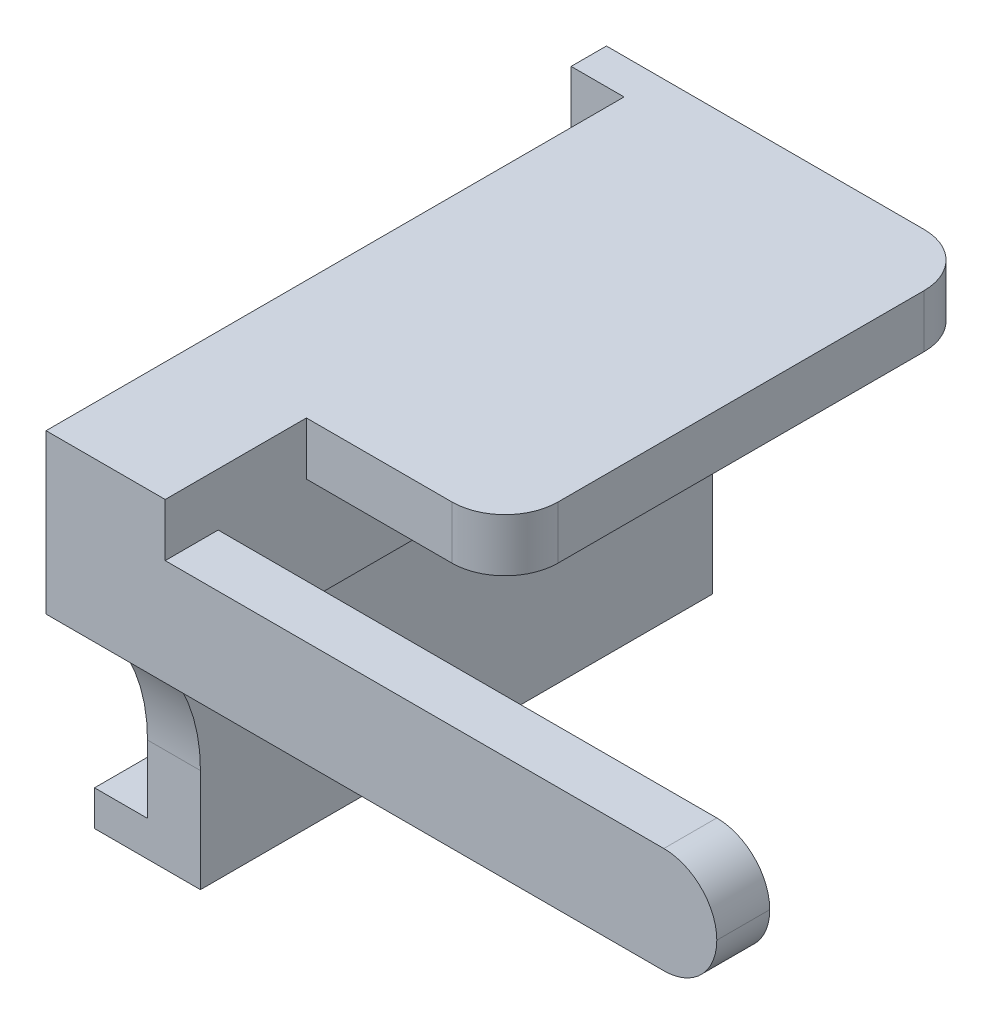
from build123d import *

# Parameters (mm, degrees)
EXTRUDE_1_DEPTH      = 5
EXTRUDE_1_DEPTH_BACK = 3
SKETCH_2_W           = 29
SKETCH_2_H           = 29
SKETCH_3_W           = 25
SKETCH_3_H           = 25
CUT_EXTRUDE_1_DEPTH  = 3
SKETCH_5_R           = 1
CUT_EXTRUDE_3_DEPTH  = 3
CUT_EXTRUDE_4_DEPTH  = 23.011360703
HOLE_WIZARD_M3_1_D   = 2.5
SKETCH_4_W           = 8
SKETCH_4_H           = 29
EXTRUDE_2_DEPTH      = 13.4052
SKETCH_7_W           = 29
SKETCH_7_H           = 5
EXTRUDE_3_DEPTH      = 5
SKETCH_10_W          = 29
SKETCH_10_H          = 13.4052
CUT_EXTRUDE_5_DEPTH  = 35.028667136
EXTRUDE_4_DEPTH      = 28
SKETCH_13_W          = 22.441758485
SKETCH_13_H          = 29
CUT_EXTRUDE_7_DEPTH  = 20.8948
SKETCH_14_W          = 27
SKETCH_14_H          = 6.1052
CUT_EXTRUDE_8_DEPTH  = 10
EXTRUDE_5_DEPTH      = 10
SKETCH_16_W          = 12.441758485
SKETCH_16_H          = 20.8948
CUT_EXTRUDE_9_DEPTH  = 5
CUT_EXTRUDE_10_DEPTH = 5
SKETCH_18_W          = 7.441758485
SKETCH_18_H          = 20.8948
CUT_EXTRUDE_11_DEPTH = 1.9068532
SKETCH_19_W          = 18
SKETCH_19_H          = 8
CUT_EXTRUDE_12_DEPTH = 7
SKETCH_20_W          = 3.0931468
SKETCH_20_H          = 11
EXTRUDE_6_DEPTH      = 20
SKETCH_21_W          = 3.0931468
SKETCH_21_H          = 2.8948
CUT_EXTRUDE_13_DEPTH = 7.441758485
SKETCH_22_W          = 29
SKETCH_22_H          = 7
CUT_EXTRUDE_14_DEPTH = 7.558241515
EXTRUDE_7_DEPTH      = 3
SKETCH_24_W          = 3
SKETCH_24_H          = 11
CUT_EXTRUDE_15_DEPTH = 50.942466899
CUT_EXTRUDE_16_DEPTH = 3.8082415
SKETCH_26_W          = 11.249999985
SKETCH_26_H          = 6.1052
CUT_EXTRUDE_17_DEPTH = 6.0931468
SKETCH_27_W          = 6.0931468
SKETCH_27_H          = 6.1052
CUT_EXTRUDE_18_DEPTH = 43.86096708
CUT_EXTRUDE_19_DEPTH = 3.1052
SKETCH_30_W          = 3.750000015
SKETCH_30_H          = 32.721043552
CUT_EXTRUDE_20_DEPTH = 7.8948
CUT_EXTRUDE_21_DEPTH = 4.9068532
SKETCH_32_W          = 31.249999985
SKETCH_32_H          = 6.0931468
CUT_EXTRUDE_22_DEPTH = 3.5
SKETCH_33_W          = 11
SKETCH_33_H          = 13.8948
EXTRUDE_8_DEPTH      = 3
SKETCH_34_W          = 11
SKETCH_34_H          = 6.3948
CUT_EXTRUDE_25_DEPTH = 49.005208051
EXTRUDE_9_DEPTH      = 0.3948
SKETCH_36_W          = 38
SKETCH_36_H          = 7.8948
CUT_EXTRUDE_26_DEPTH = 2.5931468
CUT_EXTRUDE_27_DEPTH = 3.5
SKETCH_38_W          = 1.185809648
SKETCH_38_H          = 4.3948
CUT_EXTRUDE_28_DEPTH = 3.750000015
EXTRUDE_11_DEPTH     = 3
EXTRUDE_12_REACH     = 51.952
SKETCH_41_W          = 35
SKETCH_41_H          = 4.3948
EXTRUDE_13_DEPTH     = 2.16
SKETCH_42_W          = 11.238283167
SKETCH_42_H          = 6
EXTRUDE_14_DEPTH     = 3
SKETCH_43_W          = 3
SKETCH_43_H          = 6
EXTRUDE_15_DEPTH     = 20.011716818
SKETCH_44_W          = 3.319178761
SKETCH_44_H          = 21.949008861
CUT_EXTRUDE_29_DEPTH = 47.679480755
SKETCH_45_W          = 3
SKETCH_45_H          = 4.3948
CUT_EXTRUDE_30_DEPTH = 35
SKETCH_46_W          = 5.7468532
SKETCH_46_H          = 8.544893469
EXTRUDE_16_DEPTH     = 18
SKETCH_47_W          = 11.249999985
SKETCH_47_H          = 5.544893469
CUT_EXTRUDE_31_DEPTH = 2.7468532
SKETCH_48_W          = 5.7468532
SKETCH_48_H          = 14.8948
CUT_EXTRUDE_32_DEPTH = 43.95561738
SKETCH_49_W          = 8
SKETCH_49_H          = 3
CUT_EXTRUDE_33_DEPTH = 11.249999985
FILLET_3_R           = 10
FILLET_4_R           = 3
HOLE_WIZARD_M4_1_D   = 3.3


# Some blends are built 0.0001 mm under size
with BuildPart() as part:
    # 草图2 → 凸台-拉伸1 (new, two sides: drawn at the far end of the back side and taken through both)
    with BuildSketch(Plane(origin=(0, 0, 0), x_dir=(0, 0, -1), z_dir=(1, 0, 0)).offset(-EXTRUDE_1_DEPTH_BACK)):
        Rectangle(SKETCH_2_W, SKETCH_2_H)
    extrude(amount=EXTRUDE_1_DEPTH + EXTRUDE_1_DEPTH_BACK)

    # 草图3 → 切除-拉伸1 (cut)
    with BuildSketch(Plane.ZY.offset(3)):
        Rectangle(SKETCH_3_W, SKETCH_3_H)
    extrude(amount=-CUT_EXTRUDE_1_DEPTH, mode=Mode.SUBTRACT)

    # 草图5 → 切除-拉伸3 (cut)
    with BuildSketch(Plane.ZY.offset(3)):
        with Locations((-12.5, -12.5)):
            Circle(SKETCH_5_R)
    extrude(amount=-CUT_EXTRUDE_3_DEPTH, mode=Mode.SUBTRACT)

    # 草图6 → 切除-拉伸4 (cut, through all)
    with BuildSketch(Plane.ZY.offset(3)):
        Polygon((12.5, 12.5), (12.5, -12.5), (14.5, -12.5), (14.5, 14.5), (-12.5, 14.5), (-14.5, 14.5), (-14.5, 12.5), (-12.5, 12.5), align=None)
    extrude(amount=-CUT_EXTRUDE_4_DEPTH, mode=Mode.SUBTRACT)

    # M3 螺纹孔1 (through all)
    with Locations(Plane.ZY):
        with Locations((0, 0)):
            Hole(HOLE_WIZARD_M3_1_D / 2)

    # 草图4 → 凸台-拉伸2 (add)
    with BuildSketch(Plane.XZ.offset(14.5)):
        with Locations((1, 0)):
            Rectangle(SKETCH_4_W, SKETCH_4_H)
    extrude(amount=EXTRUDE_2_DEPTH)

    # 草图7 → 凸台-拉伸3 (add)
    with BuildSketch(Plane(origin=(5, 0, 0), x_dir=(0, 0, -1), z_dir=(1, 0, 0))):
        with Locations((0, -25.4052)):
            Rectangle(SKETCH_7_W, SKETCH_7_H)
    extrude(amount=EXTRUDE_3_DEPTH)

    # 草图10 → 切除-拉伸5 (cut, through all)
    with BuildSketch(Plane.ZY.offset(3)):
        with Locations((0, -21.2026)):
            Rectangle(SKETCH_10_W, SKETCH_10_H)
    extrude(amount=-CUT_EXTRUDE_5_DEPTH, mode=Mode.SUBTRACT)

    # 草图12 → 凸台-拉伸4 (add)
    with BuildSketch(Plane(origin=(5, 0, 0), x_dir=(0, 0, -1), z_dir=(1, 0, 0))):
        Polygon((-14.5, -14.5), (14.5, -14.5), (14.5, 12.5), (-12.5, 12.5), (-12.5, -12.5), (-14.5, -12.5), align=None)
    extrude(amount=EXTRUDE_4_DEPTH)

    # 草图13 → 切除-拉伸7 (cut)
    with BuildSketch(Plane.XZ.offset(14.5)):
        with Locations((21.779120757, 0)):
            Rectangle(SKETCH_13_W, SKETCH_13_H)
    extrude(amount=-CUT_EXTRUDE_7_DEPTH, mode=Mode.SUBTRACT)

    # 草图14 → 切除-拉伸8 (cut)
    with BuildSketch(Plane(origin=(33, 0, 0), x_dir=(0, 0, -1), z_dir=(1, 0, 0))):
        with Locations((1, 9.4474)):
            Rectangle(SKETCH_14_W, SKETCH_14_H)
    extrude(amount=-CUT_EXTRUDE_8_DEPTH, mode=Mode.SUBTRACT)

    # 草图15 → 凸台-拉伸5 (add)
    with BuildSketch(Plane.XY.offset(12.5)):
        Polygon((23, 6.3948), (23, 12.5), (0, 12.5), (0, -14.5), (23, -14.5), align=None)
    extrude(amount=EXTRUDE_5_DEPTH)

    # 草图16 → 切除-拉伸9 (cut)
    with BuildSketch(Plane(origin=(0, 0, 12.5), x_dir=(-1, 0, 0), z_dir=(0, 0, -1))):
        with Locations((-16.779120757, -4.0526)):
            Rectangle(SKETCH_16_W, SKETCH_16_H)
    extrude(amount=-CUT_EXTRUDE_9_DEPTH, mode=Mode.SUBTRACT)

    # 草图17 → 切除-拉伸10 (cut)
    with BuildSketch(Plane(origin=(23, 0, 0), x_dir=(0, 0, -1), z_dir=(1, 0, 0))):
        Polygon((-17.5, -14.5), (-17.5, 6.3948), (14.5, 6.3948), (14.5, 12.5), (-22.5, 12.5), (-22.5, -14.5), align=None)
    extrude(amount=-CUT_EXTRUDE_10_DEPTH, mode=Mode.SUBTRACT)

    # 草图18 → 切除-拉伸11 (cut)
    with BuildSketch(Plane(origin=(0, 0, 17.5), x_dir=(-1, 0, 0), z_dir=(0, 0, -1))):
        with Locations((-14.279120757, -4.0526)):
            Rectangle(SKETCH_18_W, SKETCH_18_H)
    extrude(amount=-CUT_EXTRUDE_11_DEPTH, mode=Mode.SUBTRACT)

    # 草图19 → 切除-拉伸12 (cut)
    with BuildSketch(Plane.XZ.offset(14.5)):
        with Locations((9, 18.5)):
            Rectangle(SKETCH_19_W, SKETCH_19_H)
    extrude(amount=-CUT_EXTRUDE_12_DEPTH, mode=Mode.SUBTRACT)

    # 草图20 → 凸台-拉伸6 (add)
    with BuildSketch(Plane(origin=(18, 0, 0), x_dir=(0, 0, -1), z_dir=(1, 0, 0))):
        with Locations((-20.9534266, -2)):
            Rectangle(SKETCH_20_W, SKETCH_20_H)
    extrude(amount=EXTRUDE_6_DEPTH)

    # 草图21 → 切除-拉伸13 (cut)
    with BuildSketch(Plane(origin=(18, 0, 0), x_dir=(0, 0, -1), z_dir=(1, 0, 0))):
        with Locations((-20.9534266, 4.9474)):
            Rectangle(SKETCH_21_W, SKETCH_21_H)
    extrude(amount=-CUT_EXTRUDE_13_DEPTH, mode=Mode.SUBTRACT)

    # 草图22 → 切除-拉伸14 (cut)
    with BuildSketch(Plane(origin=(10.558241515, 0, 0), x_dir=(0, 0, -1), z_dir=(1, 0, 0))):
        with Locations((0, -11)):
            Rectangle(SKETCH_22_W, SKETCH_22_H)
    extrude(amount=-CUT_EXTRUDE_14_DEPTH, mode=Mode.SUBTRACT)

    # 草图23 → 凸台-拉伸7 (add)
    with BuildSketch(Plane.XY.offset(22.5)):
        Polygon((10.558241515, 6.3948), (18, 6.3948), (18, 12.5), (0, 12.5), (0, -7.5), (38, -7.5), (38, 3.5), (10.558241515, 3.5), align=None)
    extrude(amount=EXTRUDE_7_DEPTH)

    # 草图24 → 切除-拉伸15 (cut, through all)
    with BuildSketch(Plane.XZ.offset(7.5)):
        with Locations((1.5, 20)):
            Rectangle(SKETCH_24_W, SKETCH_24_H)
    extrude(amount=-CUT_EXTRUDE_15_DEPTH, mode=Mode.SUBTRACT)

    # 草图25 → 切除-拉伸16 (cut)
    with BuildSketch(Plane(origin=(10.558241515, 0, 0), x_dir=(0, 0, -1), z_dir=(1, 0, 0))):
        Polygon((-19.4068532, -7.5), (14.5, -7.5), (14.5, 6.3948), (-25.5, 6.3948), (-25.5, 3.5), (-19.4068532, 3.5), align=None)
    extrude(amount=-CUT_EXTRUDE_16_DEPTH, mode=Mode.SUBTRACT)

    # 草图26 → 切除-拉伸17 (cut)
    with BuildSketch(Plane.XY.offset(25.5)):
        with Locations((12.375000008, 9.4474)):
            Rectangle(SKETCH_26_W, SKETCH_26_H)
    extrude(amount=-CUT_EXTRUDE_17_DEPTH, mode=Mode.SUBTRACT)

    # 草图27 → 切除-拉伸18 (cut, through all)
    with BuildSketch(Plane(origin=(6.750000015, 0, 0), x_dir=(0, 0, -1), z_dir=(1, 0, 0))):
        with Locations((-22.4534266, 9.4474)):
            Rectangle(SKETCH_27_W, SKETCH_27_H)
    extrude(amount=-CUT_EXTRUDE_18_DEPTH, mode=Mode.SUBTRACT)

    # 草图28 → 切除-拉伸19 (cut)
    with BuildSketch(Plane(origin=(0, 12.5, 0), x_dir=(1, 0, 0), z_dir=(0, 1, 0))):
        Polygon((3, -14.5), (3, -19.4068532), (18, -19.4068532), (18, 14.5), (-3, 14.5), (-3, 12.5), (0, 12.5), (0, -14.5), align=None)
    extrude(amount=-CUT_EXTRUDE_19_DEPTH, mode=Mode.SUBTRACT)

    # 草图30 → 切除-拉伸20 (cut)
    with BuildSketch(Plane.XZ.offset(7.5)):
        with Locations((4.875000008, 1.860521776)):
            Rectangle(SKETCH_30_W, SKETCH_30_H)
    extrude(amount=-CUT_EXTRUDE_20_DEPTH, mode=Mode.SUBTRACT)

    # 草图31 → 切除-拉伸21 (cut)
    with BuildSketch(Plane.XY.offset(19.4068532)):
        Polygon((18, 6.3948), (18, 9.3948), (3, 9.3948), (3, 6.3948), (6.750000015, 6.3948), align=None)
    extrude(amount=-CUT_EXTRUDE_21_DEPTH, mode=Mode.SUBTRACT)

    # 草图32 → 切除-拉伸22 (cut)
    with BuildSketch(Plane(origin=(0, 3.5, 0), x_dir=(1, 0, 0), z_dir=(0, 1, 0))):
        with Locations((22.375000007, -22.4534266)):
            Rectangle(SKETCH_32_W, SKETCH_32_H)
    extrude(amount=-CUT_EXTRUDE_22_DEPTH, mode=Mode.SUBTRACT)

    # 草图33 → 凸台-拉伸8 (add)
    with BuildSketch(Plane.ZY.offset(-3)):
        with Locations((20, -0.5526)):
            Rectangle(SKETCH_33_W, SKETCH_33_H)
    extrude(amount=EXTRUDE_8_DEPTH)

    # 草图34 → 切除-拉伸25 (cut, through all)
    with BuildSketch(Plane(origin=(0, 0, 0), x_dir=(0, 0, -1), z_dir=(1, 0, 0))):
        with Locations((-20, 3.1974)):
            Rectangle(SKETCH_34_W, SKETCH_34_H)
    extrude(amount=CUT_EXTRUDE_25_DEPTH, mode=Mode.SUBTRACT)

    # 草图35 → 凸台-拉伸9 (add)
    with BuildSketch(Plane(origin=(0, 0, 0), x_dir=(1, 0, 0), z_dir=(0, 1, 0))):
        Polygon((38, -25.5), (38, -19.4068532), (6.750000015, -19.4068532), (6.750000015, -18.221043552), (3, -18.221043552), (3, -14.5), (0, -14.5), (0, -25.5), align=None)
    extrude(amount=EXTRUDE_9_DEPTH)

    # 草图36 → 切除-拉伸26 (cut)
    with BuildSketch(Plane.XY.offset(25.5)):
        with Locations((19, -3.5526)):
            Rectangle(SKETCH_36_W, SKETCH_36_H)
    extrude(amount=-CUT_EXTRUDE_26_DEPTH, mode=Mode.SUBTRACT)

    # 草图37 → 切除-拉伸27 (cut)
    with BuildSketch(Plane(origin=(0, 0.3948, 0), x_dir=(1, 0, 0), z_dir=(0, 1, 0))):
        Polygon((3, -14.5), (0, -14.5), (0, -22.9068532), (38, -22.9068532), (38, -19.4068532), (6.750000015, -19.4068532), (6.750000015, -18.221043552), (3, -18.221043552), align=None)
    extrude(amount=-CUT_EXTRUDE_27_DEPTH, mode=Mode.SUBTRACT)

    # 草图38 → 切除-拉伸28 (cut)
    with BuildSketch(Plane(origin=(6.750000015, 0, 0), x_dir=(0, 0, -1), z_dir=(1, 0, 0))):
        with Locations((-18.813948376, -5.3026)):
            Rectangle(SKETCH_38_W, SKETCH_38_H)
    extrude(amount=-CUT_EXTRUDE_28_DEPTH, mode=Mode.SUBTRACT)

    # 草图39 → 凸台-拉伸11 (add)
    with BuildSketch(Plane(origin=(3, 0, 0), x_dir=(0, 0, -1), z_dir=(1, 0, 0))):
        Polygon((-14.5, 9.3948), (-14.5, -14.5), (-22.9068532, -7.5), (-22.9068532, -3.1052), align=None)
    extrude(amount=-EXTRUDE_11_DEPTH)

    # 凸台-拉伸12: up to this face of the body (flat: up to its plane)
    extrude_12_end = Plane(part.part.faces().sort_by_distance((1.5, 3.1448, 18.7034266))[0])
    # 草图40 → 凸台-拉伸12 (add, up to the picked face)
    with BuildSketch(Plane.XY.offset(14.5), mode=Mode.PRIVATE) as extrude_12_sk1:
        Polygon((3, 9.3948), (3, 0.3948), (6.750000015, 0.3948), (6.750000015, 6.3948), (18, 6.3948), (18, 9.3948), align=None)
    extrude_12_tool1 = split(extrude(extrude_12_sk1.sketch, amount=EXTRUDE_12_REACH, mode=Mode.PRIVATE), bisect_by=extrude_12_end, keep=Keep.BOTH, mode=Mode.PRIVATE)
    add(extrude_12_tool1.solids().sort_by(Axis((3.174929, 4.8948, 14.5), (0, 0, 1)))[0])

    # 草图41 → 凸台-拉伸13 (add)
    with BuildSketch(Plane(origin=(0, 0, 19.4068532), x_dir=(-1, 0, 0), z_dir=(0, 0, -1))):
        with Locations((-20.5, -5.3026)):
            Rectangle(SKETCH_41_W, SKETCH_41_H)
    extrude(amount=EXTRUDE_13_DEPTH)

    # 草图42 → 凸台-拉伸14 (add)
    with BuildSketch(Plane(origin=(0, 0, 17.2468532), x_dir=(-1, 0, 0), z_dir=(0, 0, -1))):
        with Locations((-12.369141599, 3.3948)):
            Rectangle(SKETCH_42_W, SKETCH_42_H)
    extrude(amount=-EXTRUDE_14_DEPTH)

    # 草图43 → 凸台-拉伸15 (add)
    with BuildSketch(Plane(origin=(17.988283182, 0, 0), x_dir=(0, 0, -1), z_dir=(1, 0, 0))):
        with Locations((-18.7468532, 3.3948)):
            Rectangle(SKETCH_43_W, SKETCH_43_H)
    extrude(amount=EXTRUDE_15_DEPTH)

    # 草图44 → 切除-拉伸29 (cut, through all)
    with BuildSketch(Plane.ZY):
        with Locations((21.90644258, -4.579704431)):
            Rectangle(SKETCH_44_W, SKETCH_44_H)
    extrude(amount=-CUT_EXTRUDE_29_DEPTH, mode=Mode.SUBTRACT)

    # 草图45 → 切除-拉伸30 (cut)
    with BuildSketch(Plane(origin=(38, 0, 0), x_dir=(0, 0, -1), z_dir=(1, 0, 0))):
        with Locations((-18.7468532, -5.3026)):
            Rectangle(SKETCH_45_W, SKETCH_45_H)
    extrude(amount=-CUT_EXTRUDE_30_DEPTH, mode=Mode.SUBTRACT)

    # 草图46 → 凸台-拉伸16 (add)
    with BuildSketch(Plane.ZY):
        with Locations((17.3734266, 5.122353266)):
            Rectangle(SKETCH_46_W, SKETCH_46_H)
    extrude(amount=-EXTRUDE_16_DEPTH)

    # 草图47 → 切除-拉伸31 (cut)
    with BuildSketch(Plane(origin=(0, 0, 14.5), x_dir=(-1, 0, 0), z_dir=(0, 0, -1))):
        with Locations((-12.375000008, 3.622353266)):
            Rectangle(SKETCH_47_W, SKETCH_47_H)
    extrude(amount=-CUT_EXTRUDE_31_DEPTH, mode=Mode.SUBTRACT)

    # 草图48 → 切除-拉伸32 (cut, through all)
    with BuildSketch(Plane(origin=(3, 0, 0), x_dir=(0, 0, -1), z_dir=(1, 0, 0))):
        with Locations((-17.3734266, -7.0526)):
            Rectangle(SKETCH_48_W, SKETCH_48_H)
    extrude(amount=-CUT_EXTRUDE_32_DEPTH, mode=Mode.SUBTRACT)

    # 草图49 → 切除-拉伸33 (cut)
    with BuildSketch(Plane(origin=(18, 0, 0), x_dir=(0, 0, -1), z_dir=(1, 0, 0))):
        with Locations((-16.2468532, 7.8948)):
            Rectangle(SKETCH_49_W, SKETCH_49_H)
    extrude(amount=-CUT_EXTRUDE_33_DEPTH, mode=Mode.SUBTRACT)

    # 圆角3
    # the kernel refuses this fillet: 10 mm, written as the material it adds along each edge
    with BuildSketch(Plane(origin=(3, 0.3948, 14.5), x_dir=(0, -1, 0), z_dir=(-1, 0, 0))) as fillet_3_piece_1:
        with BuildLine():
            CenterArc((9.050455364, 10), FILLET_3_R, 205.170583254, 64.829416746)
            Line((0, 5.7468532), (0, 0))
            Line((0, 0), (9.050455364, 0))
        make_face()
    extrude(amount=3)

    # 圆角4
    fillet_4_edges = [part.edges().sort_by_distance(p)[0] for p in [
        (38, 6.3948, 18.7468532),
        (38, 0.3948, 18.7468532),
        (18, 7.8948, -14.5),
        (18, 7.8948, 12.2468532),
    ]]
    fillet(fillet_4_edges, radius=FILLET_4_R - 0.0001)  # a hair under: the kernel refuses the full size

    # M4 螺纹孔1 (through all)
    with Locations(Plane(origin=(0, 0, 0), x_dir=(0, 0, -1), z_dir=(-1, 0, 0))):
        with Locations((0, 0)):
            Hole(HOLE_WIZARD_M4_1_D / 2)


solid = part.part
